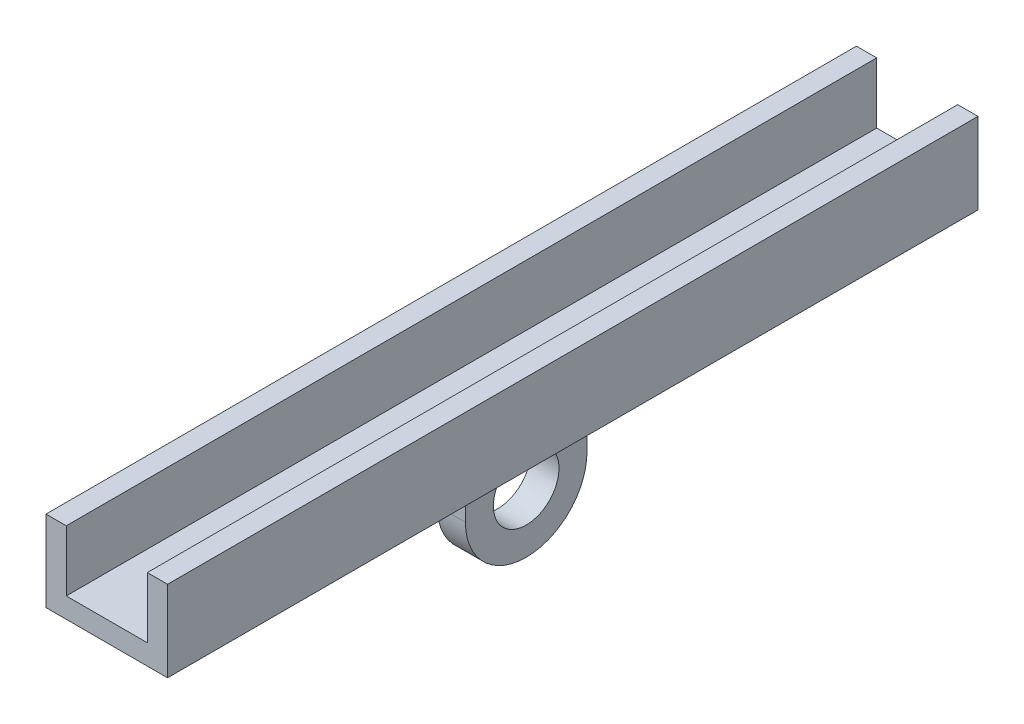
from build123d import *

# Parameters (mm, degrees)
BOSS_EXTRUDE1_DEPTH = 200
BOSS_EXTRUDE2_START = -11.5
SKETCH2_R           = 8.1
BOSS_EXTRUDE2_DEPTH = 7


with BuildPart() as part:
    # Sketch1 → Boss-Extrude1 (new body)
    with BuildSketch(Plane.XY):
        Polygon((25, 20), (30, 20), (30, 0), (0, 0), (0, 20), (5, 20), (5, 5), (25, 5), align=None)
    extrude(amount=BOSS_EXTRUDE1_DEPTH)

    # Sketch2 → Boss-Extrude2 (add)
    with BuildSketch(Plane(origin=(30, 0, 0), x_dir=(0, 0, -1), z_dir=(1, 0, 0)).offset(BOSS_EXTRUDE2_START)):
        with BuildLine():
            Line((-115, -15), (-115, -10))
            ThreePointArc((-115, -10), (-117.928932188, -2.928932188), (-125, 0))
            Line((-125, 0), (-75, 0))
            ThreePointArc((-75, 0), (-82.071067812, -2.928932188), (-85, -10))
            Line((-85, -10), (-85, -15))
            ThreePointArc((-85, -15), (-100, -30), (-115, -15))
        make_face()
        with Locations((-100, -15)):
            Circle(SKETCH2_R, mode=Mode.SUBTRACT)
    extrude(amount=-BOSS_EXTRUDE2_DEPTH)


solid = part.part
